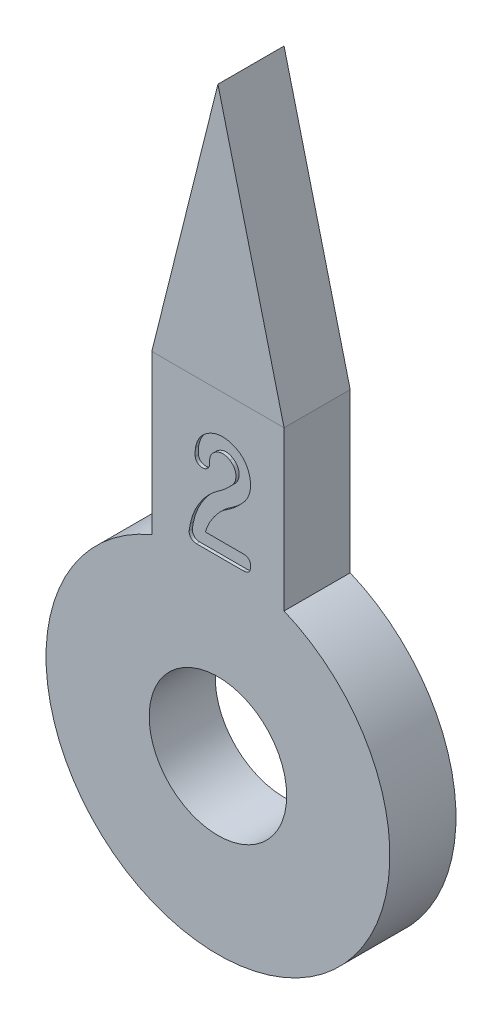
from build123d import *

# Parameters (mm, degrees)
SKETCH1_R           = 1.651
BOSS_EXTRUDE1_DEPTH = 1.5875
WRAP1_START         = -0.0762
WRAP1_DEPTH         = 0.0762


# Read off the part's stored shape, not the designer's step: Wrap1
with BuildPart() as part:
    # Sketch1 → Boss-Extrude1 (new body)
    with BuildSketch(Plane.XY):
        with BuildLine():
            Line((1.5875, 3.81), (1.5875, 7.62))
            Line((1.5875, 7.62), (0, 13.97))
            Line((0, 13.97), (-1.5875, 7.62))
            Line((-1.5875, 7.62), (-1.5875, 3.81))
            ThreePointArc((-1.5875, 3.81), (0, -4.1275), (1.5875, 3.81))
        make_face()
        Circle(SKETCH1_R, mode=Mode.SUBTRACT)
    extrude(amount=BOSS_EXTRUDE1_DEPTH)

    # Wrap1 outline → Wrap1 (cut)
    with BuildSketch(Plane.XY.offset(1.5875).offset(WRAP1_START)):
        with BuildLine():
            add(Edge.make_bspline(
                [(-0.6927271, 4.333675895), (-0.692495741, 4.33563577), (-0.691667591, 4.342651153), (-0.688769042, 4.357634786), (-0.684922586, 4.381892615), (-0.67986008, 4.412498716), (-0.674554045, 4.443717389), (-0.669757497, 4.46963377), (-0.666454834, 4.487377562), (-0.664707266, 4.496426288), (-0.664092904, 4.499607388)],
                knots=[0, 0, 0, 0, 0.035151439, 0.125824754, 0.271689381, 0.472746348, 0.678464873, 0.835817972, 0.942281445, 1, 1, 1, 1], degree=3))
            add(Edge.make_bspline(
                [(-0.51688377, 4.15746546), (-0.528701611, 4.158083472), (-0.551766092, 4.159289625), (-0.584872692, 4.169297645), (-0.615121792, 4.185426226), (-0.642244185, 4.207325789), (-0.664332359, 4.234330011), (-0.681129984, 4.264680596), (-0.690817492, 4.298344301), (-0.69208232, 4.321746179), (-0.6927271, 4.333675895)],
                knots=[0, 0, 0, 0, 0.127822844, 0.24946752, 0.37103994, 0.497334401, 0.624467945, 0.746667569, 0.870857209, 1, 1, 1, 1], degree=3))
            Line((-0.51688377, 4.15746546), (0.613065645, 4.15746546))
            add(Edge.make_bspline(
                [(0.619306431, 4.50841791), (0.632717748, 4.507153173), (0.658098658, 4.50475966), (0.693273978, 4.494445608), (0.722975165, 4.478932226), (0.747198284, 4.458294651), (0.765727881, 4.432501536), (0.778201608, 4.401557742), (0.784922795, 4.365808024), (0.785968558, 4.327125755), (0.782797594, 4.288646449), (0.774105079, 4.253571852), (0.760372999, 4.223441901), (0.740443682, 4.199291643), (0.716043821, 4.179781436), (0.685855522, 4.166902638), (0.65108202, 4.158569199), (0.62621445, 4.157847212), (0.613065645, 4.15746546)],
                knots=[0, 0, 0, 0, 0.072730168, 0.137641809, 0.196854627, 0.25270236, 0.308172367, 0.366921054, 0.43168746, 0.503873594, 0.5756551, 0.639861159, 0.698475495, 0.753049963, 0.807728666, 0.865787403, 0.929034673, 1, 1, 1, 1], degree=3))
            Line((0.619306431, 4.50841791), (-0.299924672, 4.50841791))
            add(Edge.make_bspline(
                [(-0.265416795, 4.61340996), (-0.266287441, 4.611335244), (-0.268671287, 4.605654632), (-0.272648022, 4.594488112), (-0.278056178, 4.578425355), (-0.284599105, 4.559148006), (-0.290437621, 4.540090467), (-0.295453112, 4.524748532), (-0.298353833, 4.514818948), (-0.299563911, 4.509887977), (-0.299924672, 4.50841791)],
                knots=[0, 0, 0, 0, 0.061041746, 0.16713346, 0.321479673, 0.520970162, 0.719435699, 0.862244331, 0.958930983, 1, 1, 1, 1], degree=3))
            add(Edge.make_bspline(
                [(0.027165948, 5.075595247), (0.012329066, 5.058837564), (-0.017572968, 5.025064378), (-0.06002472, 4.971553167), (-0.101552202, 4.915829097), (-0.141371923, 4.857947546), (-0.178311252, 4.798326659), (-0.211983981, 4.737785905), (-0.241000061, 4.676139025), (-0.257329382, 4.634187343), (-0.265416795, 4.61340996)],
                knots=[0, 0, 0, 0, 0.12202016, 0.245917621, 0.372291213, 0.500915216, 0.628859031, 0.754584526, 0.878453238, 1, 1, 1, 1], degree=3))
            add(Edge.make_bspline(
                [(0.391334181, 5.361937204), (0.361223865, 5.337586417), (0.300850401, 5.288761242), (0.219924135, 5.235074247), (0.155397551, 5.192066323), (0.110122794, 5.155965467), (0.066910538, 5.117642292), (0.040427943, 5.089625526), (0.027165948, 5.075595247)],
                knots=[0, 0, 0, 0, 0.250087632, 0.501444657, 0.627123169, 0.750990091, 0.875300439, 1, 1, 1, 1], degree=3))
            add(Edge.make_bspline(
                [(0.598381442, 5.56494631), (0.581926642, 5.547262699), (0.549082849, 5.511966198), (0.49868679, 5.460177761), (0.447122843, 5.409034831), (0.410033576, 5.377723514), (0.391334181, 5.361937204)],
                knots=[0, 0, 0, 0, 0.249702456, 0.49840631, 0.747110164, 1, 1, 1, 1], degree=3))
            add(Edge.make_bspline(
                [(0.33920526, 6.656716797), (0.353472465, 6.651511564), (0.381587775, 6.641254003), (0.421878928, 6.623018524), (0.46040127, 6.60379966), (0.496246373, 6.581804576), (0.530707302, 6.55893057), (0.562434404, 6.533414044), (0.592544673, 6.506642148), (0.619896671, 6.477556983), (0.645403722, 6.446910926), (0.668952012, 6.414618565), (0.690309115, 6.380391375), (0.709306159, 6.344213139), (0.726787061, 6.306508462), (0.741234339, 6.266585002), (0.754241409, 6.22511982), (0.768072724, 6.168006218), (0.780178454, 6.096569678), (0.784368607, 6.011894186), (0.778401012, 5.930079625), (0.763237068, 5.850700165), (0.736754159, 5.774454593), (0.700650258, 5.70108113), (0.65499011, 5.630171698), (0.617543834, 5.587025516), (0.598381442, 5.56494631)],
                knots=[0, 0, 0, 0, 0.034109449, 0.067216932, 0.099308832, 0.130758354, 0.161641564, 0.192170293, 0.22214936, 0.252098155, 0.281773115, 0.311689081, 0.341822813, 0.372324293, 0.403451297, 0.435115199, 0.467638762, 0.501046257, 0.567081754, 0.630114049, 0.691033314, 0.750991448, 0.811157234, 0.871775484, 0.934383635, 1, 1, 1, 1], degree=3))
            add(Edge.make_bspline(
                [(-0.538910074, 6.14387101), (-0.533666781, 6.168600667), (-0.523379004, 6.217122316), (-0.49947922, 6.286622214), (-0.46952229, 6.351736346), (-0.432141963, 6.411594101), (-0.388817022, 6.467103624), (-0.338443531, 6.517468922), (-0.281818221, 6.563499117), (-0.219357577, 6.603751762), (-0.153537671, 6.638071584), (-0.085716569, 6.665195555), (-0.016745257, 6.684019917), (0.053090433, 6.694810558), (0.123668827, 6.69725602), (0.195052802, 6.69205738), (0.26744334, 6.678845403), (0.314983363, 6.664185895), (0.33920526, 6.656716797)],
                knots=[0, 0, 0, 0, 0.065457993, 0.128434036, 0.190005232, 0.250812254, 0.310887235, 0.372102182, 0.434999136, 0.499647143, 0.564322364, 0.62709449, 0.688559438, 0.749194229, 0.80980248, 0.871165092, 0.934357921, 1, 1, 1, 1], degree=3))
            add(Edge.make_bspline(
                [(-0.54515086, 5.957748738), (-0.545718168, 5.961046078), (-0.547345693, 5.970505669), (-0.546773291, 5.989222056), (-0.547292664, 6.016483915), (-0.545797464, 6.049530152), (-0.544775877, 6.082836829), (-0.54278109, 6.110594522), (-0.541383604, 6.130127097), (-0.539569617, 6.140206325), (-0.538910074, 6.14387101)],
                knots=[0, 0, 0, 0, 0.053703755, 0.154068263, 0.299667211, 0.492577764, 0.685558541, 0.835415856, 0.940159201, 1, 1, 1, 1], degree=3))
            add(Edge.make_bspline(
                [(-0.313507559, 5.817881705), (-0.326748688, 5.814308009), (-0.352565283, 5.807340274), (-0.392277197, 5.807775651), (-0.430582168, 5.815853055), (-0.465914446, 5.832877527), (-0.497319983, 5.855880409), (-0.521377363, 5.885403501), (-0.538261794, 5.91971928), (-0.542813227, 5.944844385), (-0.54515086, 5.957748738)],
                knots=[0, 0, 0, 0, 0.132186122, 0.257726952, 0.380150903, 0.508367113, 0.634381904, 0.753877808, 0.873590673, 1, 1, 1, 1], degree=3))
            add(Edge.make_bspline(
                [(-0.198236566, 5.998864506), (-0.197479077, 5.989433957), (-0.195955535, 5.970466259), (-0.200815888, 5.941934255), (-0.210542191, 5.913916125), (-0.225203232, 5.887363551), (-0.242888924, 5.862861999), (-0.264463419, 5.843302102), (-0.287482268, 5.827105268), (-0.304880803, 5.820939094), (-0.313507559, 5.817881705)],
                knots=[0, 0, 0, 0, 0.122295461, 0.245973298, 0.371951377, 0.505452265, 0.638129912, 0.761654916, 0.881820808, 1, 1, 1, 1], degree=3))
            add(Edge.make_bspline(
                [(-0.199704987, 6.015017129), (-0.199566206, 6.013672938), (-0.199276128, 6.010863318), (-0.199164855, 6.006656873), (-0.198039254, 6.00269879), (-0.198173285, 6.000094218), (-0.198236566, 5.998864506)],
                knots=[0, 0, 0, 0, 0.249515153, 0.521535263, 0.774099595, 1, 1, 1, 1], degree=3))
            add(Edge.make_bspline(
                [(0.285975025, 6.294751195), (0.272682151, 6.302411025), (0.246820565, 6.317313396), (0.206070499, 6.333889959), (0.164895436, 6.343180125), (0.123783852, 6.347764309), (0.082451701, 6.344774208), (0.040930466, 6.336302375), (-0.000789689, 6.321390173), (-0.041463496, 6.300532784), (-0.079886926, 6.276014174), (-0.113287346, 6.247194805), (-0.142021611, 6.216160745), (-0.164514541, 6.181366891), (-0.182237478, 6.144073312), (-0.193171755, 6.103402582), (-0.200370718, 6.060183865), (-0.199930896, 6.03034404), (-0.199704987, 6.015017129)],
                knots=[0, 0, 0, 0, 0.066639456, 0.12964856, 0.190280739, 0.249604232, 0.308755828, 0.369565023, 0.433317181, 0.500628138, 0.567894957, 0.630888346, 0.691885636, 0.751037232, 0.810284388, 0.870553939, 0.933511396, 1, 1, 1, 1], degree=3))
            add(Edge.make_bspline(
                [(0.343243416, 5.806868553), (0.351118523, 5.816407152), (0.366580785, 5.835135574), (0.386597777, 5.865012057), (0.402782369, 5.896097243), (0.415819128, 5.928119207), (0.424960671, 5.961266887), (0.430570708, 5.995358807), (0.432217895, 6.030307207), (0.430871446, 6.06572163), (0.425827166, 6.10070134), (0.417013572, 6.134350041), (0.404442271, 6.166146407), (0.388279505, 6.196056065), (0.368152112, 6.223808343), (0.34445221, 6.249741409), (0.316833874, 6.273573162), (0.296395252, 6.287599927), (0.285975025, 6.294751195)],
                knots=[0, 0, 0, 0, 0.065983685, 0.129554698, 0.191477678, 0.252715103, 0.313711813, 0.374582555, 0.43670492, 0.500101288, 0.563453918, 0.624910304, 0.685299263, 0.74549372, 0.805843828, 0.867780579, 0.932590547, 1, 1, 1, 1], degree=3))
            add(Edge.make_bspline(
                [(0.023494898, 5.525298962), (0.053077007, 5.546024218), (0.110773274, 5.586446284), (0.191248753, 5.654420756), (0.268021717, 5.7279068), (0.317633659, 5.779985467), (0.343243416, 5.806868553)],
                knots=[0, 0, 0, 0, 0.25365197, 0.494716981, 0.739172156, 1, 1, 1, 1], degree=3))
            add(Edge.make_bspline(
                [(-0.664092904, 4.499607388), (-0.658464763, 4.524753093), (-0.647193012, 4.575113612), (-0.625796845, 4.649765684), (-0.600307799, 4.723379254), (-0.571857224, 4.796338257), (-0.538895385, 4.867967849), (-0.502663605, 4.938847518), (-0.462420857, 5.008682301), (-0.419106564, 5.077470685), (-0.372126214, 5.143890883), (-0.323106184, 5.207984837), (-0.27111994, 5.26850968), (-0.217145112, 5.326365759), (-0.160639031, 5.380988853), (-0.101805622, 5.43256559), (-0.040448995, 5.480747144), (0.002179636, 5.510447916), (0.023494898, 5.525298962)],
                knots=[0, 0, 0, 0, 0.061108243, 0.122384435, 0.184064158, 0.245829863, 0.308042655, 0.37099844, 0.434574042, 0.499151414, 0.563730742, 0.627472417, 0.690465657, 0.752889321, 0.815082475, 0.876788142, 0.938391336, 1, 1, 1, 1], degree=3))
        make_face()
    extrude(amount=WRAP1_DEPTH, mode=Mode.SUBTRACT)


solid = part.part
